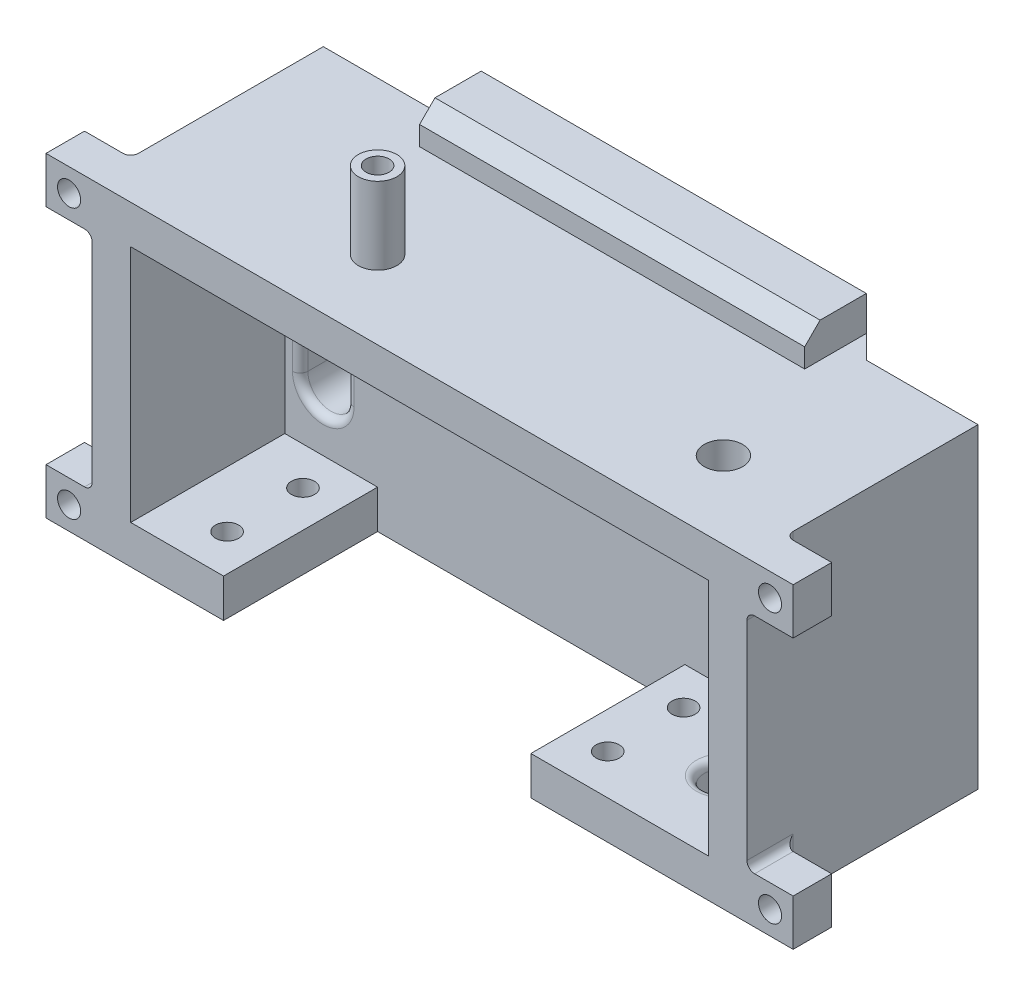
from build123d import *

# Parameters (mm, degrees)
BOSS_EXTRUDE3_DEPTH  = 20
SKETCH4_W            = 85
SKETCH4_H            = 41
BOSS_EXTRUDE4_DEPTH  = 10
SKETCH5_R            = 2.5
CUT_EXTRUDE1_DEPTH   = 5
CUT_EXTRUDE2_START   = -5
SKETCH6_R            = 2.5
CUT_EXTRUDE2_DEPTH   = 5
FILLET2_R            = 1
SKETCH7_R            = 1.5
CUT_EXTRUDE3_DEPTH   = 5
CUT_EXTRUDE4_DEPTH   = 10
FILLET3_R            = 1
SKETCH10_W           = 50
SKETCH10_H           = 50
BOSS_EXTRUDE7_DEPTH  = 5
SKETCH9_W            = 50
SKETCH9_H            = 50
BOSS_EXTRUDE8_DEPTH  = 5
SKETCH11_R           = 0.75
CUT_EXTRUDE5_DEPTH   = 5
CHAMFER1_SIZE        = 2
CHAMFER2_SIZE        = 3
SKETCH15_W           = 6
SKETCH15_H           = 6
SKETCH15_R           = 1.5
BOSS_EXTRUDE11_DEPTH = 5
LPATTERN1_COUNT      = 2
LPATTERN1_PITCH      = 35
LPATTERN1_COUNT_DIR2 = 2
LPATTERN1_PITCH_DIR2 = 91
FILLET5_R            = 1
SKETCH16_R           = 2.5
BOSS_EXTRUDE12_DEPTH = 10
SKETCH17_R           = 1.5
CUT_EXTRUDE8_DEPTH   = 5


with BuildPart() as part:
    # Sketch3 → Boss-Extrude3 (new body)
    with BuildSketch(Plane.XY):
        Polygon((5, 36), (5, 5), (17.05, 5), (17.05, 0), (0, 0), (0, 41), (5, 41), (80, 41), (85, 41), (85, 0), (56.95, 0), (56.95, 5), (80, 5), (80, 36), align=None)
    extrude(amount=BOSS_EXTRUDE3_DEPTH)

    # Sketch4 → Boss-Extrude4 (add)
    with BuildSketch(Plane(origin=(0, 0, 0), x_dir=(-1, 0, 0), z_dir=(0, 0, -1))):
        with Locations((-42.5, 20.5)):
            Rectangle(SKETCH4_W, SKETCH4_H)
    extrude(amount=BOSS_EXTRUDE4_DEPTH)

    # Sketch5 → Cut-Extrude1 (cut)
    with BuildSketch(Plane(origin=(0, 5, 0), x_dir=(1, 0, 0), z_dir=(0, 1, 0))):
        with Locations(Location((71.95, -10, 0), (0, 0, 270))):
            Circle(SKETCH5_R)
    extrude(amount=-CUT_EXTRUDE1_DEPTH, mode=Mode.SUBTRACT)

    # Sketch6 → Cut-Extrude2 (cut)
    with BuildSketch(Plane.XZ.offset(-36).offset(CUT_EXTRUDE2_START)):
        with Locations(Location((71.95, 10, 0), (0, 0, 90))):
            Circle(SKETCH6_R)
    extrude(amount=CUT_EXTRUDE2_DEPTH, mode=Mode.SUBTRACT)

    # Fillet2
    fillet2_edges = [part.edges().sort_by_distance(p)[0] for p in [
        (71.95, 5, 7.5),
        (71.95, 36, 7.5),
    ]]
    fillet(fillet2_edges, radius=FILLET2_R)

    # Sketch7 → Cut-Extrude3 (cut)
    with BuildSketch(Plane(origin=(0, 5, 0), x_dir=(1, 0, 0), z_dir=(0, 1, 0))):
        with Locations(Location((12.29, -4.93, 0), (0, 0, 270))):
            Circle(SKETCH7_R)
        with Locations(Location((12.29, -14.78, 0), (0, 0, 270))):
            Circle(SKETCH7_R)
    cut_extrude3 = extrude(amount=-CUT_EXTRUDE3_DEPTH, mode=Mode.SUBTRACT)

    # Mirror1: Cut-Extrude3 across plane
    add(cut_extrude3.mirror(Plane(origin=(37, 0, 0), x_dir=(0, 0, 1), z_dir=(1, 0, 0))), mode=Mode.SUBTRACT)

    # Sketch8 → Cut-Extrude4 (cut)
    with BuildSketch(Plane.XY):
        with BuildLine():
            Line((13, 27.5), (13, 12.5))
            ThreePointArc((13, 12.5), (10, 9.5), (7, 12.5))
            Line((7, 12.5), (7, 27.5))
            ThreePointArc((7, 27.5), (10, 30.5), (13, 27.5))
        make_face()
    extrude(amount=-CUT_EXTRUDE4_DEPTH, mode=Mode.SUBTRACT)

    # Fillet3
    fillet3_edges = [part.edges().sort_by_distance(p)[0] for p in [
        (10, 30.5, 0),
        (7, 20, 0),
        (10, 9.5, 0),
        (13, 20, 0),
    ]]
    fillet(fillet3_edges, radius=FILLET3_R)

    # Sketch10 → Boss-Extrude7 (add)
    with BuildSketch(Plane(origin=(0, 0, -10), x_dir=(-1, 0, 0), z_dir=(0, 0, -1))):
        with Locations((-42.5, 20.5)):
            Rectangle(SKETCH10_W, SKETCH10_H)
    extrude(amount=-BOSS_EXTRUDE7_DEPTH)

    # Sketch9 → Boss-Extrude8 (add)
    with BuildSketch(Plane(origin=(0, 0, -10), x_dir=(-1, 0, 0), z_dir=(0, 0, -1))):
        with Locations((-42.5, 20.5)):
            Rectangle(SKETCH9_W, SKETCH9_H)
        with BuildLine():
            Line((-59.2, 24.3), (-48.011787453, 24.5))
            ThreePointArc((-48.011787453, 24.5), (-46.919880362, 24.919880362), (-46.5, 26.011787453))
            Line((-46.5, 26.011787453), (-46.3, 37.2))
            ThreePointArc((-46.3, 37.2), (-42.5, 41), (-38.7, 37.2))
            Line((-38.7, 37.2), (-38.5, 26.011787453))
            ThreePointArc((-38.5, 26.011787453), (-38.080119638, 24.919880362), (-36.988212547, 24.5))
            Line((-36.988212547, 24.5), (-25.8, 24.3))
            ThreePointArc((-25.8, 24.3), (-22, 20.5), (-25.8, 16.7))
            Line((-25.8, 16.7), (-36.988212547, 16.5))
            ThreePointArc((-36.988212547, 16.5), (-38.080119638, 16.080119638), (-38.5, 14.988212547))
            Line((-38.5, 14.988212547), (-38.7, 3.8))
            ThreePointArc((-38.7, 3.8), (-42.5, 0), (-46.3, 3.8))
            Line((-46.3, 3.8), (-46.5, 14.988212547))
            ThreePointArc((-46.5, 14.988212547), (-46.919880362, 16.080119638), (-48.011787453, 16.5))
            Line((-48.011787453, 16.5), (-59.2, 16.7))
            ThreePointArc((-59.2, 16.7), (-63, 20.5), (-59.2, 24.3))
        make_face(mode=Mode.SUBTRACT)
    extrude(amount=BOSS_EXTRUDE8_DEPTH)

    # Sketch11 → Cut-Extrude5 (cut)
    with BuildSketch(Plane(origin=(0, 0, -10), x_dir=(-1, 0, 0), z_dir=(0, 0, -1))):
        with Locations((-59, 20.5)):
            Circle(SKETCH11_R)
        with Locations(Location((-26, 20.5, 0), (0, 0, 180))):
            Circle(SKETCH11_R)
    extrude(amount=-CUT_EXTRUDE5_DEPTH, mode=Mode.SUBTRACT)

    # Chamfer1
    chamfer1_edges = [part.edges().sort_by_distance(p)[0] for p in [
        (42.5, 45.5, -5),
        (42.5, -4.5, -5),
        (67.5, 20.5, -15),
        (42.5, -4.5, -15),
        (17.5, 20.5, -15),
        (42.5, 45.5, -15),
    ]]
    chamfer(chamfer1_edges, length=CHAMFER1_SIZE)

    # Chamfer2
    chamfer2_edges = [part.edges().sort_by_distance(p)[0] for p in [
        (17.5, 20.5, -10),
        (67.5, 20.5, -10),
    ]]
    chamfer(chamfer2_edges, length=CHAMFER2_SIZE - 0.0001)  # a hair under: the kernel refuses the full size

    # Sketch15 → Boss-Extrude11 (add)
    with BuildSketch(Plane.XY.offset(20)):
        with Locations((-3, 38)):
            Rectangle(SKETCH15_W, SKETCH15_H)
        with Locations((-3, 38)):
            Circle(SKETCH15_R, mode=Mode.SUBTRACT)
    boss_extrude11 = extrude(amount=-BOSS_EXTRUDE11_DEPTH)

    # LPattern1: Boss-Extrude11 2 × 2
    with Locations(*[(j * LPATTERN1_PITCH_DIR2, -i * LPATTERN1_PITCH, 0) for i in range(LPATTERN1_COUNT) for j in range(LPATTERN1_COUNT_DIR2) if (i, j) != (0, 0)]):
        add(boss_extrude11)

    # Fillet5
    fillet5_edges = [part.edges().sort_by_distance(p)[0] for p in [
        (0, 38, 15),
        (0, 35, 17.5),
        (85, 38, 15),
        (85, 35, 17.5),
        (0, 3, 15),
        (0, 6, 17.5),
        (85, 3, 15),
        (85, 6, 17.5),
    ]]
    fillet(fillet5_edges, radius=FILLET5_R)

    # Sketch16 → Boss-Extrude12 (add)
    with BuildSketch(Plane(origin=(0, 41, 0), x_dir=(1, 0, 0), z_dir=(0, 1, 0))):
        with Locations(Location((26.900249723, -9.85, 0), (0, 0, 90))):
            Circle(SKETCH16_R)
    extrude(amount=BOSS_EXTRUDE12_DEPTH)

    # Sketch17 → Cut-Extrude8 (cut)
    with BuildSketch(Plane(origin=(0, 51, 0), x_dir=(1, 0, 0), z_dir=(0, 1, 0))):
        with Locations(Location((26.900249723, -9.85, 0), (0, 0, 270))):
            Circle(SKETCH17_R)
    extrude(amount=-CUT_EXTRUDE8_DEPTH, mode=Mode.SUBTRACT)


solid = part.part
